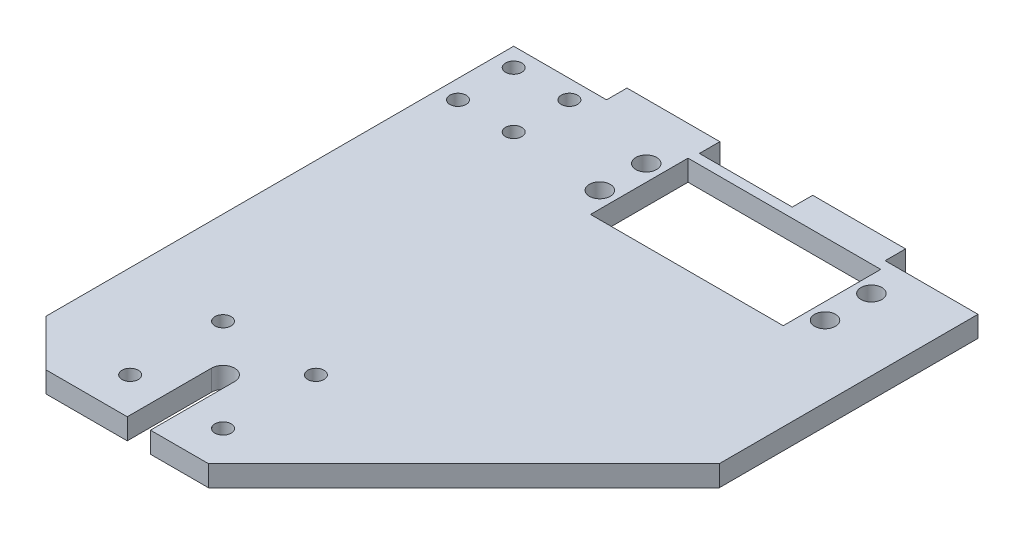
from build123d import *

# Parameters (mm, degrees)
SKETCH2_W           = 220
SKETCH2_H           = 140
BOSS_EXTRUDE1_DEPTH = 4.5
SKETCH3_R           = 2.5
CUT_EXTRUDE1_DEPTH  = 131.461680198
SKETCH4_W           = 20
SKETCH4_H           = 4.4
TEETH_CUT_DEPTH     = 131.461680198
TRIM_CUT_DEPTH      = 131.461680198
SKETCH6_R           = 2.25
SKETCH6_R_2         = 1.75
SKETCH6_W           = 41.5
SKETCH6_H           = 21
CUT_EXTRUDE2_DEPTH  = 100.097174531
CHAMFER4_SIZE       = 10
CHAMFER5_SIZE       = 55


with BuildPart() as part:
    # Sketch2 → Boss-Extrude1 (new body)
    with BuildSketch(Plane(origin=(0, 0, 0), x_dir=(1, 0, 0), z_dir=(0, 1, 0))):
        Rectangle(SKETCH2_W, SKETCH2_H)
    extrude(amount=BOSS_EXTRUDE1_DEPTH)

    # Sketch3 → Cut-Extrude1 (cut, through all)
    with BuildSketch(Plane(origin=(0, 4.5, 0), x_dir=(1, 0, 0), z_dir=(0, 1, 0))):
        with Locations((40.6, 53)):
            Circle(SKETCH3_R)
        with BuildLine():
            Line((-2.5, -27), (-2.5, -70))
            Line((-2.5, -70), (2.5, -70))
            Line((2.5, -70), (2.5, -27))
            ThreePointArc((2.5, -27), (0, -24.5), (-2.5, -27))
        make_face()
    extrude(amount=-CUT_EXTRUDE1_DEPTH, mode=Mode.SUBTRACT)

    # Sketch4 → Teeth cut (cut, through all)
    with BuildSketch(Plane.XZ):
        with Locations((100, -67.8)):
            Rectangle(SKETCH4_W, SKETCH4_H)
        with Locations((60, -67.8)):
            Rectangle(SKETCH4_W, SKETCH4_H)
        with Locations((20, -67.8)):
            Rectangle(SKETCH4_W, SKETCH4_H)
        with Locations((-20, -67.8)):
            Rectangle(SKETCH4_W, SKETCH4_H)
        with Locations((-60, -67.8)):
            Rectangle(SKETCH4_W, SKETCH4_H)
        with Locations((-100, -67.8)):
            Rectangle(SKETCH4_W, SKETCH4_H)
    extrude(amount=-TEETH_CUT_DEPTH, mode=Mode.SUBTRACT)

    # Sketch5 → Trim cut (cut, through all)
    with BuildSketch(Plane.XZ):
        Polygon((110, -70.1), (70, -70.1), (70, 45.124241674), (-30, 45.124241674), (-30, -70.1), (-110, -70.1), (-110, 70), (-30, 70), (70, 70), (110, 70), align=None)
    extrude(amount=-TRIM_CUT_DEPTH, mode=Mode.SUBTRACT)

    # Sketch6 → Cut-Extrude2 (cut, through all)
    with BuildSketch(Plane(origin=(0, 4.5, 0), x_dir=(1, 0, 0), z_dir=(0, 1, 0))):
        with Locations((6.15, 58)):
            Circle(SKETCH6_R)
        with Locations((6.15, 48)):
            Circle(SKETCH6_R)
        with Locations((54.65, 48)):
            Circle(SKETCH6_R)
        with Locations((54.65, 58)):
            Circle(SKETCH6_R)
        with Locations((-14, 49.6)):
            Circle(SKETCH6_R_2)
        with Locations((10, -17)):
            Circle(SKETCH6_R_2)
        with Locations((10, -37)):
            Circle(SKETCH6_R_2)
        with Locations((-10, -37)):
            Circle(SKETCH6_R_2)
        with Locations((-10, -17)):
            Circle(SKETCH6_R_2)
        with Locations((-26, 49.6)):
            Circle(SKETCH6_R_2)
        with Locations((-26, 61.6)):
            Circle(SKETCH6_R_2)
        with Locations((-14, 61.6)):
            Circle(SKETCH6_R_2)
        with Locations((30.4, 53)):
            Rectangle(SKETCH6_W, SKETCH6_H)
    extrude(amount=-CUT_EXTRUDE2_DEPTH, mode=Mode.SUBTRACT)

    # Chamfer4
    chamfer4_edges = [part.edges().sort_by_distance(p)[0] for p in [
        (-30, 2.25, 45.124241674),
    ]]
    chamfer(chamfer4_edges, length=CHAMFER4_SIZE)

    # Chamfer5
    chamfer5_edges = [part.edges().sort_by_distance(p)[0] for p in [
        (70, 2.25, 45.124241674),
    ]]
    chamfer(chamfer5_edges, length=CHAMFER5_SIZE)


solid = part.part
